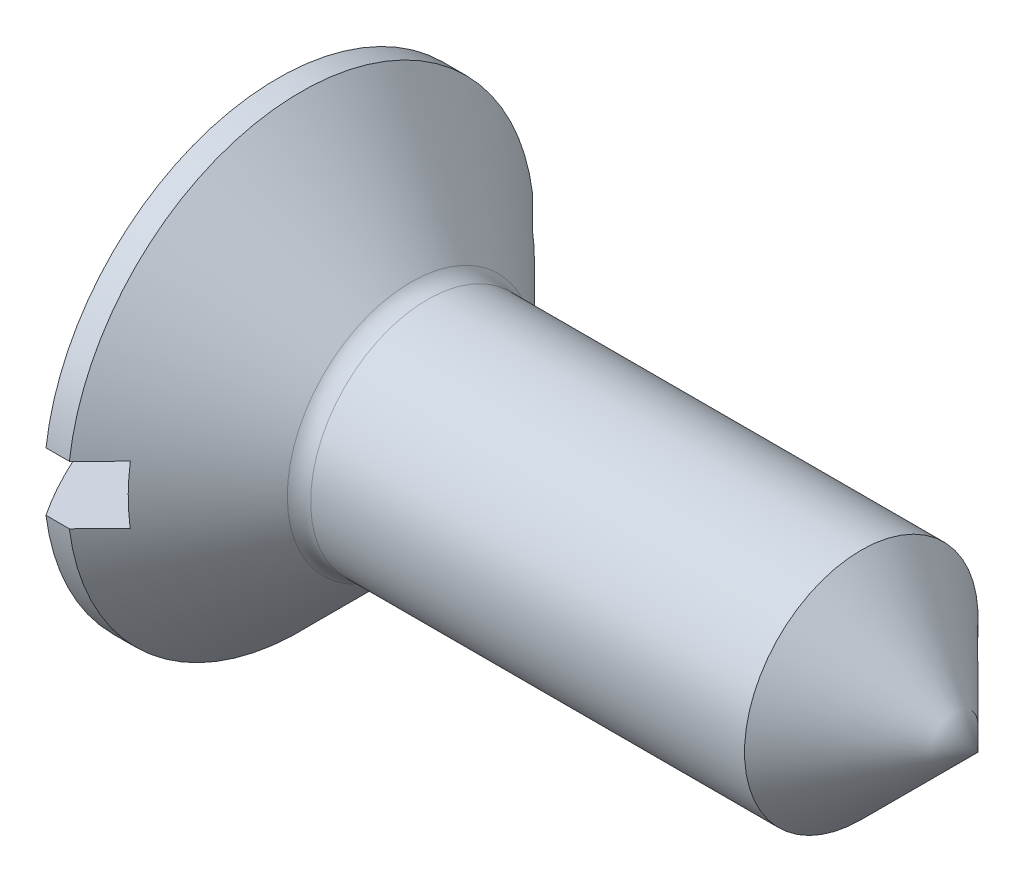
from build123d import *

# Parameters (mm, degrees)
SKETCH1_R          = 1
BASEBODY_DEPTH     = 4.8
SKETCH3_R          = 2.2
SKETCH3_R_2        = 2
CUT_EXTRUDE1_DEPTH = 7.758698099
SLOT_DEPTH         = 7.017224311
SLOT_DEPTH_BACK    = 7.017224311
SKETCH5_W          = 0.5
SKETCH5_H          = 1.06
FILLET1_R          = 0.2


with BuildPart() as part:
    # Sketch2 → BaseHead (revolve)
    with BuildSketch(Plane(origin=(1.691547262, 0, 0.508452738), x_dir=(0, 0, -1), z_dir=(0, 1, 0))):
        Polygon((0.508452738, 0.491547262), (1.508452738, 0.491547262), (2.708452738, 1.691547262), (0.508452738, 1.691547262), align=None)
    revolve(axis=Axis((6, 0, 0), (-1, 0, 0)))

    # Sketch1 → BaseBody (add)
    with BuildSketch(Plane(origin=(1.2, 0.243512281, -0.448198582), x_dir=(0, 0, -1), z_dir=(1, 0, 0))):
        with Locations((-0.448198582, -0.243512281)):
            Circle(SKETCH1_R)
    extrude(amount=BASEBODY_DEPTH)

    # Sketch3 → Cut-Extrude1 (cut, through all)
    with BuildSketch(Plane(origin=(0, 0, 0), x_dir=(0, 0, -1), z_dir=(1, 0, 0))):
        Circle(SKETCH3_R)
        Circle(SKETCH3_R_2, mode=Mode.SUBTRACT)
    extrude(amount=CUT_EXTRUDE1_DEPTH, mode=Mode.SUBTRACT)

    # Sketch4 → BaseTop (revolve)
    with BuildSketch(Plane(origin=(2.485835614, 0, -0.485835614), x_dir=(0, 0, -1), z_dir=(0, 1, 0))):
        with BuildLine():
            Line((-0.235835614, 3.085835614), (-0.235835614, 2.485835614))
            Line((-0.235835614, 2.485835614), (1.514164386, 2.485835614))
            ThreePointArc((1.514164386, 2.485835614), (0.678364094, 2.900168098), (-0.235835614, 3.085835614))
        make_face()
    revolve(axis=Axis((2.485835614, 0, 0), (-1, 0, 0)))

    # Sketch5 → Slot (cut, two sides: drawn at the far end of the back side and taken through both)
    with BuildSketch(Plane(origin=(1.678295732, 1.678295732, 0), x_dir=(0, 1, 0), z_dir=(0, 0, 1)).offset(-SLOT_DEPTH_BACK)):
        with Locations((-1.678295732, 1.748295732)):
            Rectangle(SKETCH5_W, SKETCH5_H)
    extrude(amount=SLOT_DEPTH + SLOT_DEPTH_BACK, mode=Mode.SUBTRACT)

    # Fillet1
    fillet1_edges = [part.edges().sort_by_distance(p)[0] for p in [
        (1.2, 0, 1),
    ]]
    fillet(fillet1_edges, radius=FILLET1_R)

    # Sketch6 → Cut-Revolve1 (revolve, cut)
    with BuildSketch(Plane(origin=(12.798369632, -7.201630368, 0), x_dir=(0, 1, 0), z_dir=(0, 0, 1))):
        Polygon((7.201630368, 6.053668682), (27.201630368, 6.053668682), (27.201630368, 26.798369632), (7.201630368, 6.798369632), align=None)
    revolve(axis=Axis((16.635932076, 0, 0), (1, 0, 0)), mode=Mode.SUBTRACT)


solid = part.part
